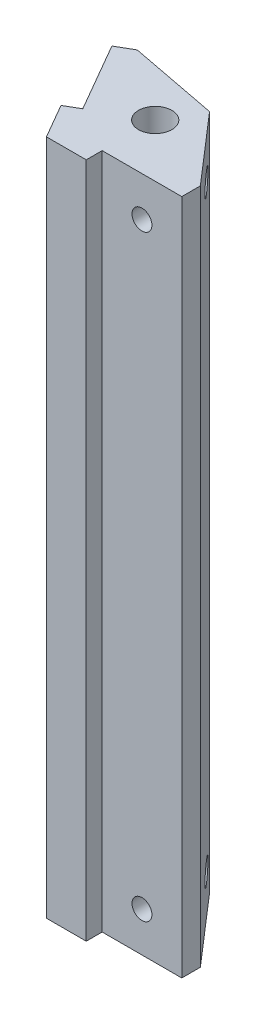
from build123d import *

# Parameters (mm, degrees)
BOSS_EXTRUDE1_DEPTH       = 85
SKETCH3_W                 = 10
SKETCH3_H                 = 2
CUT_EXTRUDE1_DEPTH        = 88.633826232
M5X0_8_TAPPED_HOLE1_D     = 4.2
M5X0_8_TAPPED_HOLE1_DEPTH = 16
M5X0_8_TAPPED_HOLE1_TIP   = 1.2618073
M5X0_8_TAPPED_HOLE2_D     = 4.2
M5X0_8_TAPPED_HOLE2_DEPTH = 16.4
M5X0_8_TAPPED_HOLE2_TIP   = 1.2618073
M3X0_5_TAPPED_HOLE1_D     = 2.5
M3X0_5_TAPPED_HOLE2_D     = 2.5


with BuildPart() as part:
    # Sketch1 → Boss-Extrude1 (new body)
    with BuildSketch(Plane(origin=(0, 0, 0), x_dir=(1, 0, 0), z_dir=(0, 1, 0))):
        Polygon((0, 0), (15, 0), (15, 4.330127019), (7.5, 12.990381057), (-3.75, 15.155444566), (-7.5, 12.990381057), align=None)
    extrude(amount=BOSS_EXTRUDE1_DEPTH)

    # Sketch3 → Cut-Extrude1 (cut, through all)
    with BuildSketch(Plane(origin=(0, 85, 0), x_dir=(1, 0, 0), z_dir=(0, 1, 0))):
        Polygon((-7.5, 12.990381057), (-5.767949192, 13.990381057), (-0.767949192, 5.330127019), (-2.5, 4.330127019), align=None)
        with Locations((10, 1)):
            Rectangle(SKETCH3_W, SKETCH3_H)
    extrude(amount=-CUT_EXTRUDE1_DEPTH, mode=Mode.SUBTRACT)

    # M5x0.8 Tapped Hole1
    with Locations(Plane(origin=(0, 85, 0), x_dir=(1, 0, 0), z_dir=(0, 1, 0))):
        with Locations((5, 8.660254038)):
            Hole(M5X0_8_TAPPED_HOLE1_D / 2, depth=M5X0_8_TAPPED_HOLE1_DEPTH)
            with Locations((0, 0, -(M5X0_8_TAPPED_HOLE1_DEPTH + M5X0_8_TAPPED_HOLE1_TIP / 2))):  # 118° drill point
                Cone(0, M5X0_8_TAPPED_HOLE1_D / 2, M5X0_8_TAPPED_HOLE1_TIP, mode=Mode.SUBTRACT)

    # M5x0.8 Tapped Hole2
    with Locations(Plane(origin=(0, 0, 0), x_dir=(-1, 0, 0), z_dir=(0, -1, 0))):
        with Locations((-5, 8.660254038)):
            Hole(M5X0_8_TAPPED_HOLE2_D / 2, depth=M5X0_8_TAPPED_HOLE2_DEPTH)
            with Locations((0, 0, -(M5X0_8_TAPPED_HOLE2_DEPTH + M5X0_8_TAPPED_HOLE2_TIP / 2))):  # 118° drill point
                Cone(0, M5X0_8_TAPPED_HOLE2_D / 2, M5X0_8_TAPPED_HOLE2_TIP, mode=Mode.SUBTRACT)

    # M3x0.5 Tapped Hole1 (through all)
    with Locations(Plane(origin=(1.732050808, 0, -1), x_dir=(0.49999999999999983, 0, 0.8660254037844387), z_dir=(-0.8660254037844387, 0, 0.49999999999999983))):
        with Locations((-10, 80), (-10, 5)):
            Hole(M3X0_5_TAPPED_HOLE1_D / 2)

    # M3x0.5 Tapped Hole2 (through all)
    with Locations(Plane.XY.offset(-2)):
        with Locations((10, 80), (10, 5)):
            Hole(M3X0_5_TAPPED_HOLE2_D / 2)


solid = part.part
